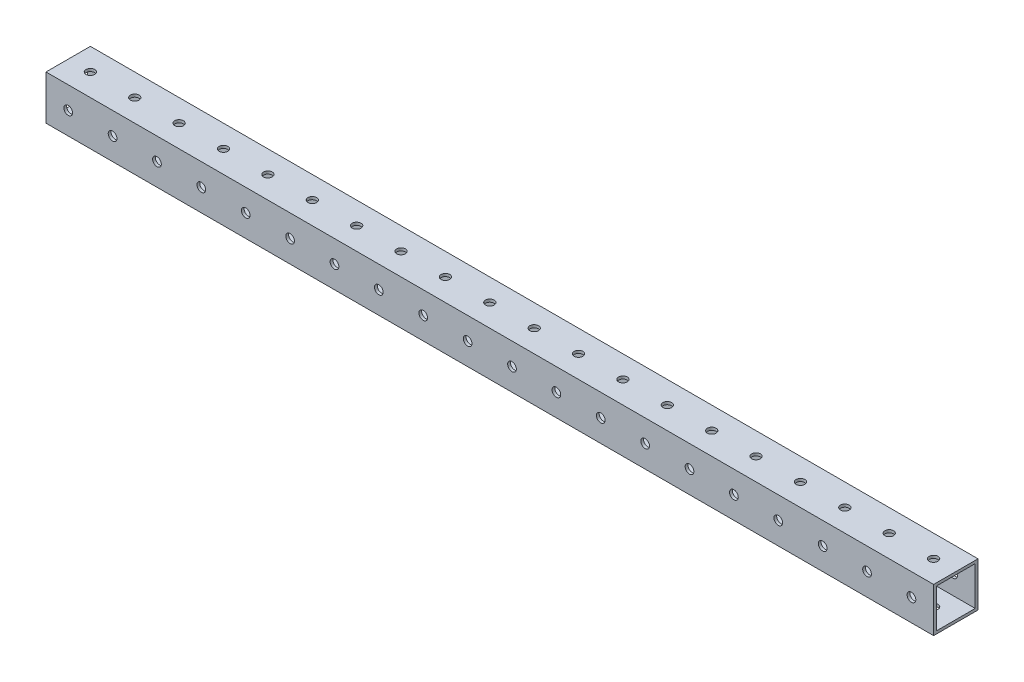
from build123d import *

# Parameters (mm, degrees)
SKETCH1_W             = 25.4
SKETCH1_H             = 25.4
SKETCH1_W_2           = 22.225
SKETCH1_H_2           = 22.225
BOSS_EXTRUDE1_DEPTH   = 254
SKETCH3_W             = 2.4892
SKETCH3_H             = 25.4
SKETCH3_AT_POINT_2_W  = 2.4892
SKETCH3_AT_POINT_2_H  = 25.4
LPATTERN1_START       = -12.7
LPATTERN1_OUTLINE_R   = 2.4892
LPATTERN1_DEPTH       = 25.4
LPATTERN1_2_OUTLINE_R = 2.4892
LPATTERN1_2_DEPTH     = 25.4


# Read off the part's stored shape, not the designer's step: LPattern1
with BuildPart() as part:
    # Sketch1 → Boss-Extrude1 (new, symmetric)
    with BuildSketch(Plane(origin=(0, 0, 0), x_dir=(0, 0, -1), z_dir=(1, 0, 0))):
        Rectangle(SKETCH1_W, SKETCH1_H)
        Rectangle(SKETCH1_W_2, SKETCH1_H_2, mode=Mode.SUBTRACT)
    extrude(amount=BOSS_EXTRUDE1_DEPTH, both=True)

    # Sketch3 → #9 (0.196) Diameter Hole1 (revolve, cut)
    with BuildSketch(Plane(origin=(241.3, 12.7, 0), x_dir=(0, 0, 1), z_dir=(1, 0, 0))):
        with Locations((1.2446, 12.7)):
            Rectangle(SKETCH3_W, SKETCH3_H)
    revolve(axis=Axis((241.3, 19.05, 0), (0, -1, 0)), mode=Mode.SUBTRACT)

    # Sketch3 at point 2 (carried to point 2, square into its face) → #9 (0.196) Diameter Hole1 at 2 (revolve, cut)
    with BuildSketch(Plane(origin=(241.3, 0, 12.7), x_dir=(0, -1, 0), z_dir=(1, 0, 0))):
        with Locations((1.2446, 12.7)):
            Rectangle(SKETCH3_AT_POINT_2_W, SKETCH3_AT_POINT_2_H)
    revolve(axis=Axis((241.3, 0, 19.05), (0, 0, -1)), mode=Mode.SUBTRACT)

    # LPattern1 outline → LPattern1 (cut)
    with BuildSketch(Plane.XY.offset(LPATTERN1_START)):
        with Locations((215.9, 0)):
            Circle(LPATTERN1_OUTLINE_R)
        with Locations((190.5, 0)):
            Circle(LPATTERN1_OUTLINE_R)
        with Locations((165.1, 0)):
            Circle(LPATTERN1_OUTLINE_R)
        with Locations((139.7, 0)):
            Circle(LPATTERN1_OUTLINE_R)
        with Locations((114.3, 0)):
            Circle(LPATTERN1_OUTLINE_R)
        with Locations((88.9, 0)):
            Circle(LPATTERN1_OUTLINE_R)
        with Locations((63.5, 0)):
            Circle(LPATTERN1_OUTLINE_R)
        with Locations((38.1, 0)):
            Circle(LPATTERN1_OUTLINE_R)
        with Locations((12.7, 0)):
            Circle(LPATTERN1_OUTLINE_R)
        with Locations((-12.7, 0)):
            Circle(LPATTERN1_OUTLINE_R)
        with Locations((-38.1, 0)):
            Circle(LPATTERN1_OUTLINE_R)
        with Locations((-63.5, 0)):
            Circle(LPATTERN1_OUTLINE_R)
        with Locations((-88.9, 0)):
            Circle(LPATTERN1_OUTLINE_R)
        with Locations((-114.3, 0)):
            Circle(LPATTERN1_OUTLINE_R)
        with Locations((-139.7, 0)):
            Circle(LPATTERN1_OUTLINE_R)
        with Locations((-165.1, 0)):
            Circle(LPATTERN1_OUTLINE_R)
        with Locations((-190.5, 0)):
            Circle(LPATTERN1_OUTLINE_R)
        with Locations((-215.9, 0)):
            Circle(LPATTERN1_OUTLINE_R)
        with Locations((-241.3, 0)):
            Circle(LPATTERN1_OUTLINE_R)
    extrude(amount=LPATTERN1_DEPTH, mode=Mode.SUBTRACT)

    # LPattern1 2 outline → LPattern1 2 (cut)
    with BuildSketch(Plane(origin=(0, 0, 0), x_dir=(1, 0, 0), z_dir=(0, 1, 0)).offset(LPATTERN1_START)):
        with Locations((215.9, 0)):
            Circle(LPATTERN1_2_OUTLINE_R)
        with Locations((190.5, 0)):
            Circle(LPATTERN1_2_OUTLINE_R)
        with Locations((165.1, 0)):
            Circle(LPATTERN1_2_OUTLINE_R)
        with Locations((139.7, 0)):
            Circle(LPATTERN1_2_OUTLINE_R)
        with Locations((114.3, 0)):
            Circle(LPATTERN1_2_OUTLINE_R)
        with Locations((88.9, 0)):
            Circle(LPATTERN1_2_OUTLINE_R)
        with Locations((63.5, 0)):
            Circle(LPATTERN1_2_OUTLINE_R)
        with Locations((38.1, 0)):
            Circle(LPATTERN1_2_OUTLINE_R)
        with Locations((12.7, 0)):
            Circle(LPATTERN1_2_OUTLINE_R)
        with Locations((-12.7, 0)):
            Circle(LPATTERN1_2_OUTLINE_R)
        with Locations((-38.1, 0)):
            Circle(LPATTERN1_2_OUTLINE_R)
        with Locations((-63.5, 0)):
            Circle(LPATTERN1_2_OUTLINE_R)
        with Locations((-88.9, 0)):
            Circle(LPATTERN1_2_OUTLINE_R)
        with Locations((-114.3, 0)):
            Circle(LPATTERN1_2_OUTLINE_R)
        with Locations((-139.7, 0)):
            Circle(LPATTERN1_2_OUTLINE_R)
        with Locations((-165.1, 0)):
            Circle(LPATTERN1_2_OUTLINE_R)
        with Locations((-190.5, 0)):
            Circle(LPATTERN1_2_OUTLINE_R)
        with Locations((-215.9, 0)):
            Circle(LPATTERN1_2_OUTLINE_R)
        with Locations((-241.3, 0)):
            Circle(LPATTERN1_2_OUTLINE_R)
    extrude(amount=LPATTERN1_2_DEPTH, mode=Mode.SUBTRACT)


solid = part.part
